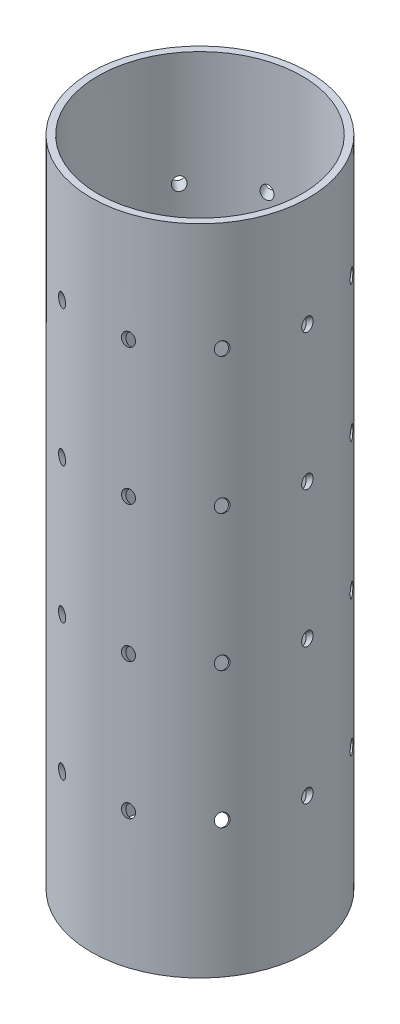
from build123d import *

# Parameters (mm, degrees)
SKETCH1_R                  = 50.8
SKETCH1_R_2                = 47.625
BOSS_EXTRUDE1_DEPTH        = 304.8
CUT_EXTRUDE1_REACH         = 290.782
SKETCH4_R                  = 2.6162
CIRPATTERN1_COUNT          = 10
LPATTERN2_COPY_1_REACH     = 290.782
LPATTERN2_COPY_1_SKETCH_R  = 2.6162
LPATTERN2_COPY_2_REACH     = 290.782
LPATTERN2_COPY_2_SKETCH_R  = 2.6162
LPATTERN2_COPY_3_REACH     = 290.782
LPATTERN2_COPY_3_SKETCH_R  = 2.6162
LPATTERN2_COPY_4_REACH     = 290.782
LPATTERN2_COPY_4_SKETCH_R  = 2.6162
LPATTERN2_COPY_5_REACH     = 290.782
LPATTERN2_COPY_5_SKETCH_R  = 2.6162
LPATTERN2_COPY_6_REACH     = 290.782
LPATTERN2_COPY_6_SKETCH_R  = 2.6162
LPATTERN2_COPY_7_REACH     = 290.782
LPATTERN2_COPY_7_SKETCH_R  = 2.6162
LPATTERN2_COPY_8_REACH     = 290.782
LPATTERN2_COPY_8_SKETCH_R  = 2.6162
LPATTERN2_COPY_9_REACH     = 290.782
LPATTERN2_COPY_9_SKETCH_R  = 2.6162
LPATTERN2_COPY_10_REACH    = 290.782
LPATTERN2_COPY_10_SKETCH_R = 2.6162
LPATTERN2_COPY_11_REACH    = 290.782
LPATTERN2_COPY_11_SKETCH_R = 2.6162
LPATTERN2_COPY_12_REACH    = 290.782
LPATTERN2_COPY_12_SKETCH_R = 2.6162
LPATTERN2_COPY_13_REACH    = 290.782
LPATTERN2_COPY_13_SKETCH_R = 2.6162
LPATTERN2_COPY_14_REACH    = 290.782
LPATTERN2_COPY_14_SKETCH_R = 2.6162
LPATTERN2_COPY_15_REACH    = 290.782
LPATTERN2_COPY_15_SKETCH_R = 2.6162
LPATTERN2_COPY_16_REACH    = 290.782
LPATTERN2_COPY_16_SKETCH_R = 2.6162
LPATTERN2_COPY_17_REACH    = 290.782
LPATTERN2_COPY_17_SKETCH_R = 2.6162
LPATTERN2_COPY_18_REACH    = 290.782
LPATTERN2_COPY_18_SKETCH_R = 2.6162
LPATTERN2_COPY_19_REACH    = 290.782
LPATTERN2_COPY_19_SKETCH_R = 2.6162
LPATTERN2_COPY_20_REACH    = 290.782
LPATTERN2_COPY_20_SKETCH_R = 2.6162
LPATTERN2_COPY_21_REACH    = 290.782
LPATTERN2_COPY_21_SKETCH_R = 2.6162
LPATTERN2_COPY_22_REACH    = 290.782
LPATTERN2_COPY_22_SKETCH_R = 2.6162
LPATTERN2_COPY_23_REACH    = 290.782
LPATTERN2_COPY_23_SKETCH_R = 2.6162
LPATTERN2_COPY_24_REACH    = 290.782
LPATTERN2_COPY_24_SKETCH_R = 2.6162
LPATTERN2_COPY_25_REACH    = 290.782
LPATTERN2_COPY_25_SKETCH_R = 2.6162
LPATTERN2_COPY_26_REACH    = 290.782
LPATTERN2_COPY_26_SKETCH_R = 2.6162
LPATTERN2_COPY_27_REACH    = 290.782
LPATTERN2_COPY_27_SKETCH_R = 2.6162
LPATTERN2_COPY_28_REACH    = 290.782
LPATTERN2_COPY_28_SKETCH_R = 2.6162
LPATTERN2_COPY_29_REACH    = 290.782
LPATTERN2_COPY_29_SKETCH_R = 2.6162
LPATTERN2_COPY_30_REACH    = 290.782
LPATTERN2_COPY_30_SKETCH_R = 2.6162


with BuildPart() as part:
    # Sketch1 → Boss-Extrude1 (new body)
    with BuildSketch(Plane(origin=(0, 0, 0), x_dir=(1, 0, 0), z_dir=(0, 1, 0))):
        Circle(SKETCH1_R)
        Circle(SKETCH1_R_2, mode=Mode.SUBTRACT)
    extrude(amount=BOSS_EXTRUDE1_DEPTH)

    # Sketch4 → Cut-Extrude1 (cut, up to next)
    with BuildSketch(Plane(origin=(61.203230962, 261.284420742, 0), x_dir=(0, 0, -1), z_dir=(0.8191520442889912, 0.5735764363510469, 0)), mode=Mode.PRIVATE) as cut_extrude1_sk1:
        with Locations((-0.614368328, 0)):
            Circle(SKETCH4_R)
    cut_extrude1_tool1 = extrude(cut_extrude1_sk1.sketch, amount=-CUT_EXTRUDE1_REACH, mode=Mode.PRIVATE) & part.part
    cut_extrude1 = cut_extrude1_tool1.solids().sort_by_distance((61.203231, 261.284421, 0.614368))[0]
    add(cut_extrude1, mode=Mode.SUBTRACT)

    # CirPattern1: Cut-Extrude1 ×10 about axis
    cirpattern1_axis = Axis((0, 304.8, 0), (0, 1, 0))
    for i in range(1, CIRPATTERN1_COUNT):
        add(cut_extrude1.rotate(cirpattern1_axis, i * 360 / CIRPATTERN1_COUNT), mode=Mode.SUBTRACT)

    # LPattern2 copy 1 sketch → LPattern2 copy 1 (cut, up to next)
    with BuildSketch(Plane(origin=(49.514453959, 197.784420742, -35.974356552), x_dir=(-0.5877852522924731, 0, -0.8090169943749475), z_dir=(0.6627079248067735, 0.5735764363510469, -0.48148549101829985)), mode=Mode.PRIVATE) as lpattern2_copy_1_sk1:
        with Locations((-0.614368328, 0)):
            Circle(LPATTERN2_COPY_1_SKETCH_R)
    lpattern2_copy_1_tool1 = extrude(lpattern2_copy_1_sk1.sketch, amount=-LPATTERN2_COPY_1_REACH, mode=Mode.PRIVATE) & part.part
    add(lpattern2_copy_1_tool1.solids().sort_by_distance((49.87557044, 197.784421, -35.477322422))[0], mode=Mode.SUBTRACT)

    # LPattern2 copy 2 sketch → LPattern2 copy 2 (cut, up to next)
    with BuildSketch(Plane(origin=(49.514453959, 134.284420742, -35.974356552), x_dir=(-0.5877852522924731, 0, -0.8090169943749475), z_dir=(0.6627079248067735, 0.5735764363510469, -0.48148549101829985)), mode=Mode.PRIVATE) as lpattern2_copy_2_sk1:
        with Locations((-0.614368328, 0)):
            Circle(LPATTERN2_COPY_2_SKETCH_R)
    lpattern2_copy_2_tool1 = extrude(lpattern2_copy_2_sk1.sketch, amount=-LPATTERN2_COPY_2_REACH, mode=Mode.PRIVATE) & part.part
    add(lpattern2_copy_2_tool1.solids().sort_by_distance((49.87557044, 134.284421, -35.477322422))[0], mode=Mode.SUBTRACT)

    # LPattern2 copy 3 sketch → LPattern2 copy 3 (cut, up to next)
    with BuildSketch(Plane(origin=(49.514453959, 70.784420742, -35.974356552), x_dir=(-0.5877852522924731, 0, -0.8090169943749475), z_dir=(0.6627079248067735, 0.5735764363510469, -0.48148549101829985)), mode=Mode.PRIVATE) as lpattern2_copy_3_sk1:
        with Locations((-0.614368328, 0)):
            Circle(LPATTERN2_COPY_3_SKETCH_R)
    lpattern2_copy_3_tool1 = extrude(lpattern2_copy_3_sk1.sketch, amount=-LPATTERN2_COPY_3_REACH, mode=Mode.PRIVATE) & part.part
    add(lpattern2_copy_3_tool1.solids().sort_by_distance((49.87557044, 70.784421, -35.477322422))[0], mode=Mode.SUBTRACT)

    # LPattern2 copy 4 sketch → LPattern2 copy 4 (cut, up to next)
    with BuildSketch(Plane(origin=(18.912838478, 197.784420742, -58.207731625), x_dir=(-0.9510565162951535, 0, -0.30901699437494745), z_dir=(0.2531319026622779, 0.5735764363510469, -0.7790598895575414)), mode=Mode.PRIVATE) as lpattern2_copy_4_sk1:
        with Locations((-0.614368328, 0)):
            Circle(LPATTERN2_COPY_4_SKETCH_R)
    lpattern2_copy_4_tool1 = extrude(lpattern2_copy_4_sk1.sketch, amount=-LPATTERN2_COPY_4_REACH, mode=Mode.PRIVATE) & part.part
    add(lpattern2_copy_4_tool1.solids().sort_by_distance((19.497137179, 197.784421, -58.017881508))[0], mode=Mode.SUBTRACT)

    # LPattern2 copy 5 sketch → LPattern2 copy 5 (cut, up to next)
    with BuildSketch(Plane(origin=(18.912838478, 134.284420742, -58.207731625), x_dir=(-0.9510565162951535, 0, -0.30901699437494745), z_dir=(0.2531319026622779, 0.5735764363510469, -0.7790598895575414)), mode=Mode.PRIVATE) as lpattern2_copy_5_sk1:
        with Locations((-0.614368328, 0)):
            Circle(LPATTERN2_COPY_5_SKETCH_R)
    lpattern2_copy_5_tool1 = extrude(lpattern2_copy_5_sk1.sketch, amount=-LPATTERN2_COPY_5_REACH, mode=Mode.PRIVATE) & part.part
    add(lpattern2_copy_5_tool1.solids().sort_by_distance((19.497137179, 134.284421, -58.017881508))[0], mode=Mode.SUBTRACT)

    # LPattern2 copy 6 sketch → LPattern2 copy 6 (cut, up to next)
    with BuildSketch(Plane(origin=(18.912838478, 70.784420742, -58.207731625), x_dir=(-0.9510565162951535, 0, -0.30901699437494745), z_dir=(0.2531319026622779, 0.5735764363510469, -0.7790598895575414)), mode=Mode.PRIVATE) as lpattern2_copy_6_sk1:
        with Locations((-0.614368328, 0)):
            Circle(LPATTERN2_COPY_6_SKETCH_R)
    lpattern2_copy_6_tool1 = extrude(lpattern2_copy_6_sk1.sketch, amount=-LPATTERN2_COPY_6_REACH, mode=Mode.PRIVATE) & part.part
    add(lpattern2_copy_6_tool1.solids().sort_by_distance((19.497137179, 70.784421, -58.017881508))[0], mode=Mode.SUBTRACT)

    # LPattern2 copy 7 sketch → LPattern2 copy 7 (cut, up to next)
    with BuildSketch(Plane(origin=(-18.912838478, 197.784420742, -58.207731625), x_dir=(-0.9510565162951536, 0, 0.30901699437494734), z_dir=(-0.2531319026622778, 0.5735764363510469, -0.7790598895575415)), mode=Mode.PRIVATE) as lpattern2_copy_7_sk1:
        with Locations((-0.614368328, 0)):
            Circle(LPATTERN2_COPY_7_SKETCH_R)
    lpattern2_copy_7_tool1 = extrude(lpattern2_copy_7_sk1.sketch, amount=-LPATTERN2_COPY_7_REACH, mode=Mode.PRIVATE) & part.part
    add(lpattern2_copy_7_tool1.solids().sort_by_distance((-18.3285398, 197.784421, -58.397581814))[0], mode=Mode.SUBTRACT)

    # LPattern2 copy 8 sketch → LPattern2 copy 8 (cut, up to next)
    with BuildSketch(Plane(origin=(-18.912838478, 134.284420742, -58.207731625), x_dir=(-0.9510565162951536, 0, 0.30901699437494734), z_dir=(-0.2531319026622778, 0.5735764363510469, -0.7790598895575415)), mode=Mode.PRIVATE) as lpattern2_copy_8_sk1:
        with Locations((-0.614368328, 0)):
            Circle(LPATTERN2_COPY_8_SKETCH_R)
    lpattern2_copy_8_tool1 = extrude(lpattern2_copy_8_sk1.sketch, amount=-LPATTERN2_COPY_8_REACH, mode=Mode.PRIVATE) & part.part
    add(lpattern2_copy_8_tool1.solids().sort_by_distance((-18.3285398, 134.284421, -58.397581814))[0], mode=Mode.SUBTRACT)

    # LPattern2 copy 9 sketch → LPattern2 copy 9 (cut, up to next)
    with BuildSketch(Plane(origin=(-18.912838478, 70.784420742, -58.207731625), x_dir=(-0.9510565162951536, 0, 0.30901699437494734), z_dir=(-0.2531319026622778, 0.5735764363510469, -0.7790598895575415)), mode=Mode.PRIVATE) as lpattern2_copy_9_sk1:
        with Locations((-0.614368328, 0)):
            Circle(LPATTERN2_COPY_9_SKETCH_R)
    lpattern2_copy_9_tool1 = extrude(lpattern2_copy_9_sk1.sketch, amount=-LPATTERN2_COPY_9_REACH, mode=Mode.PRIVATE) & part.part
    add(lpattern2_copy_9_tool1.solids().sort_by_distance((-18.3285398, 70.784421, -58.397581814))[0], mode=Mode.SUBTRACT)

    # LPattern2 copy 10 sketch → LPattern2 copy 10 (cut, up to next)
    with BuildSketch(Plane(origin=(-49.514453959, 197.784420742, -35.974356552), x_dir=(-0.5877852522924732, 0, 0.8090169943749473), z_dir=(-0.6627079248067734, 0.5735764363510469, -0.48148549101829996)), mode=Mode.PRIVATE) as lpattern2_copy_10_sk1:
        with Locations((-0.614368328, 0)):
            Circle(LPATTERN2_COPY_10_SKETCH_R)
    lpattern2_copy_10_tool1 = extrude(lpattern2_copy_10_sk1.sketch, amount=-LPATTERN2_COPY_10_REACH, mode=Mode.PRIVATE) & part.part
    add(lpattern2_copy_10_tool1.solids().sort_by_distance((-49.15333754, 197.784421, -36.471390727))[0], mode=Mode.SUBTRACT)

    # LPattern2 copy 11 sketch → LPattern2 copy 11 (cut, up to next)
    with BuildSketch(Plane(origin=(-49.514453959, 134.284420742, -35.974356552), x_dir=(-0.5877852522924732, 0, 0.8090169943749473), z_dir=(-0.6627079248067734, 0.5735764363510469, -0.48148549101829996)), mode=Mode.PRIVATE) as lpattern2_copy_11_sk1:
        with Locations((-0.614368328, 0)):
            Circle(LPATTERN2_COPY_11_SKETCH_R)
    lpattern2_copy_11_tool1 = extrude(lpattern2_copy_11_sk1.sketch, amount=-LPATTERN2_COPY_11_REACH, mode=Mode.PRIVATE) & part.part
    add(lpattern2_copy_11_tool1.solids().sort_by_distance((-49.15333754, 134.284421, -36.471390727))[0], mode=Mode.SUBTRACT)

    # LPattern2 copy 12 sketch → LPattern2 copy 12 (cut, up to next)
    with BuildSketch(Plane(origin=(-49.514453959, 70.784420742, -35.974356552), x_dir=(-0.5877852522924732, 0, 0.8090169943749473), z_dir=(-0.6627079248067734, 0.5735764363510469, -0.48148549101829996)), mode=Mode.PRIVATE) as lpattern2_copy_12_sk1:
        with Locations((-0.614368328, 0)):
            Circle(LPATTERN2_COPY_12_SKETCH_R)
    lpattern2_copy_12_tool1 = extrude(lpattern2_copy_12_sk1.sketch, amount=-LPATTERN2_COPY_12_REACH, mode=Mode.PRIVATE) & part.part
    add(lpattern2_copy_12_tool1.solids().sort_by_distance((-49.15333754, 70.784421, -36.471390727))[0], mode=Mode.SUBTRACT)

    # LPattern2 copy 13 sketch → LPattern2 copy 13 (cut, up to next)
    with BuildSketch(Plane(origin=(-61.203230962, 197.784420742, 0), x_dir=(0, 0, 1), z_dir=(-0.8191520442889912, 0.5735764363510469, 0)), mode=Mode.PRIVATE) as lpattern2_copy_13_sk1:
        with Locations((-0.614368328, 0)):
            Circle(LPATTERN2_COPY_13_SKETCH_R)
    lpattern2_copy_13_tool1 = extrude(lpattern2_copy_13_sk1.sketch, amount=-LPATTERN2_COPY_13_REACH, mode=Mode.PRIVATE) & part.part
    add(lpattern2_copy_13_tool1.solids().sort_by_distance((-61.203231, 197.784421, -0.614368))[0], mode=Mode.SUBTRACT)

    # LPattern2 copy 14 sketch → LPattern2 copy 14 (cut, up to next)
    with BuildSketch(Plane(origin=(-61.203230962, 134.284420742, 0), x_dir=(0, 0, 1), z_dir=(-0.8191520442889912, 0.5735764363510469, 0)), mode=Mode.PRIVATE) as lpattern2_copy_14_sk1:
        with Locations((-0.614368328, 0)):
            Circle(LPATTERN2_COPY_14_SKETCH_R)
    lpattern2_copy_14_tool1 = extrude(lpattern2_copy_14_sk1.sketch, amount=-LPATTERN2_COPY_14_REACH, mode=Mode.PRIVATE) & part.part
    add(lpattern2_copy_14_tool1.solids().sort_by_distance((-61.203231, 134.284421, -0.614368))[0], mode=Mode.SUBTRACT)

    # LPattern2 copy 15 sketch → LPattern2 copy 15 (cut, up to next)
    with BuildSketch(Plane(origin=(-61.203230962, 70.784420742, 0), x_dir=(0, 0, 1), z_dir=(-0.8191520442889912, 0.5735764363510469, 0)), mode=Mode.PRIVATE) as lpattern2_copy_15_sk1:
        with Locations((-0.614368328, 0)):
            Circle(LPATTERN2_COPY_15_SKETCH_R)
    lpattern2_copy_15_tool1 = extrude(lpattern2_copy_15_sk1.sketch, amount=-LPATTERN2_COPY_15_REACH, mode=Mode.PRIVATE) & part.part
    add(lpattern2_copy_15_tool1.solids().sort_by_distance((-61.203231, 70.784421, -0.614368))[0], mode=Mode.SUBTRACT)

    # LPattern2 copy 16 sketch → LPattern2 copy 16 (cut, up to next)
    with BuildSketch(Plane(origin=(-49.514453959, 197.784420742, 35.974356552), x_dir=(0.587785252292473, 0, 0.8090169943749476), z_dir=(-0.6627079248067737, 0.5735764363510468, 0.48148549101829974)), mode=Mode.PRIVATE) as lpattern2_copy_16_sk1:
        with Locations((-0.614368328, 0)):
            Circle(LPATTERN2_COPY_16_SKETCH_R)
    lpattern2_copy_16_tool1 = extrude(lpattern2_copy_16_sk1.sketch, amount=-LPATTERN2_COPY_16_REACH, mode=Mode.PRIVATE) & part.part
    add(lpattern2_copy_16_tool1.solids().sort_by_distance((-49.87557044, 197.784421, 35.477322422))[0], mode=Mode.SUBTRACT)

    # LPattern2 copy 17 sketch → LPattern2 copy 17 (cut, up to next)
    with BuildSketch(Plane(origin=(-49.514453959, 134.284420742, 35.974356552), x_dir=(0.587785252292473, 0, 0.8090169943749476), z_dir=(-0.6627079248067737, 0.5735764363510468, 0.48148549101829974)), mode=Mode.PRIVATE) as lpattern2_copy_17_sk1:
        with Locations((-0.614368328, 0)):
            Circle(LPATTERN2_COPY_17_SKETCH_R)
    lpattern2_copy_17_tool1 = extrude(lpattern2_copy_17_sk1.sketch, amount=-LPATTERN2_COPY_17_REACH, mode=Mode.PRIVATE) & part.part
    add(lpattern2_copy_17_tool1.solids().sort_by_distance((-49.87557044, 134.284421, 35.477322422))[0], mode=Mode.SUBTRACT)

    # LPattern2 copy 18 sketch → LPattern2 copy 18 (cut, up to next)
    with BuildSketch(Plane(origin=(-49.514453959, 70.784420742, 35.974356552), x_dir=(0.587785252292473, 0, 0.8090169943749476), z_dir=(-0.6627079248067737, 0.5735764363510468, 0.48148549101829974)), mode=Mode.PRIVATE) as lpattern2_copy_18_sk1:
        with Locations((-0.614368328, 0)):
            Circle(LPATTERN2_COPY_18_SKETCH_R)
    lpattern2_copy_18_tool1 = extrude(lpattern2_copy_18_sk1.sketch, amount=-LPATTERN2_COPY_18_REACH, mode=Mode.PRIVATE) & part.part
    add(lpattern2_copy_18_tool1.solids().sort_by_distance((-49.87557044, 70.784421, 35.477322422))[0], mode=Mode.SUBTRACT)

    # LPattern2 copy 19 sketch → LPattern2 copy 19 (cut, up to next)
    with BuildSketch(Plane(origin=(-18.912838478, 197.784420742, 58.207731625), x_dir=(0.9510565162951535, 0, 0.30901699437494756), z_dir=(-0.25313190266227803, 0.5735764363510468, 0.7790598895575414)), mode=Mode.PRIVATE) as lpattern2_copy_19_sk1:
        with Locations((-0.614368328, 0)):
            Circle(LPATTERN2_COPY_19_SKETCH_R)
    lpattern2_copy_19_tool1 = extrude(lpattern2_copy_19_sk1.sketch, amount=-LPATTERN2_COPY_19_REACH, mode=Mode.PRIVATE) & part.part
    add(lpattern2_copy_19_tool1.solids().sort_by_distance((-19.497137179, 197.784421, 58.017881508))[0], mode=Mode.SUBTRACT)

    # LPattern2 copy 20 sketch → LPattern2 copy 20 (cut, up to next)
    with BuildSketch(Plane(origin=(-18.912838478, 134.284420742, 58.207731625), x_dir=(0.9510565162951535, 0, 0.30901699437494756), z_dir=(-0.25313190266227803, 0.5735764363510468, 0.7790598895575414)), mode=Mode.PRIVATE) as lpattern2_copy_20_sk1:
        with Locations((-0.614368328, 0)):
            Circle(LPATTERN2_COPY_20_SKETCH_R)
    lpattern2_copy_20_tool1 = extrude(lpattern2_copy_20_sk1.sketch, amount=-LPATTERN2_COPY_20_REACH, mode=Mode.PRIVATE) & part.part
    add(lpattern2_copy_20_tool1.solids().sort_by_distance((-19.497137179, 134.284421, 58.017881508))[0], mode=Mode.SUBTRACT)

    # LPattern2 copy 21 sketch → LPattern2 copy 21 (cut, up to next)
    with BuildSketch(Plane(origin=(-18.912838478, 70.784420742, 58.207731625), x_dir=(0.9510565162951535, 0, 0.30901699437494756), z_dir=(-0.25313190266227803, 0.5735764363510468, 0.7790598895575414)), mode=Mode.PRIVATE) as lpattern2_copy_21_sk1:
        with Locations((-0.614368328, 0)):
            Circle(LPATTERN2_COPY_21_SKETCH_R)
    lpattern2_copy_21_tool1 = extrude(lpattern2_copy_21_sk1.sketch, amount=-LPATTERN2_COPY_21_REACH, mode=Mode.PRIVATE) & part.part
    add(lpattern2_copy_21_tool1.solids().sort_by_distance((-19.497137179, 70.784421, 58.017881508))[0], mode=Mode.SUBTRACT)

    # LPattern2 copy 22 sketch → LPattern2 copy 22 (cut, up to next)
    with BuildSketch(Plane(origin=(18.912838478, 197.784420742, 58.207731625), x_dir=(0.9510565162951536, 0, -0.30901699437494723), z_dir=(0.25313190266227775, 0.5735764363510469, 0.7790598895575415)), mode=Mode.PRIVATE) as lpattern2_copy_22_sk1:
        with Locations((-0.614368328, 0)):
            Circle(LPATTERN2_COPY_22_SKETCH_R)
    lpattern2_copy_22_tool1 = extrude(lpattern2_copy_22_sk1.sketch, amount=-LPATTERN2_COPY_22_REACH, mode=Mode.PRIVATE) & part.part
    add(lpattern2_copy_22_tool1.solids().sort_by_distance((18.3285398, 197.784421, 58.397581814))[0], mode=Mode.SUBTRACT)

    # LPattern2 copy 23 sketch → LPattern2 copy 23 (cut, up to next)
    with BuildSketch(Plane(origin=(18.912838478, 134.284420742, 58.207731625), x_dir=(0.9510565162951536, 0, -0.30901699437494723), z_dir=(0.25313190266227775, 0.5735764363510469, 0.7790598895575415)), mode=Mode.PRIVATE) as lpattern2_copy_23_sk1:
        with Locations((-0.614368328, 0)):
            Circle(LPATTERN2_COPY_23_SKETCH_R)
    lpattern2_copy_23_tool1 = extrude(lpattern2_copy_23_sk1.sketch, amount=-LPATTERN2_COPY_23_REACH, mode=Mode.PRIVATE) & part.part
    add(lpattern2_copy_23_tool1.solids().sort_by_distance((18.3285398, 134.284421, 58.397581814))[0], mode=Mode.SUBTRACT)

    # LPattern2 copy 24 sketch → LPattern2 copy 24 (cut, up to next)
    with BuildSketch(Plane(origin=(18.912838478, 70.784420742, 58.207731625), x_dir=(0.9510565162951536, 0, -0.30901699437494723), z_dir=(0.25313190266227775, 0.5735764363510469, 0.7790598895575415)), mode=Mode.PRIVATE) as lpattern2_copy_24_sk1:
        with Locations((-0.614368328, 0)):
            Circle(LPATTERN2_COPY_24_SKETCH_R)
    lpattern2_copy_24_tool1 = extrude(lpattern2_copy_24_sk1.sketch, amount=-LPATTERN2_COPY_24_REACH, mode=Mode.PRIVATE) & part.part
    add(lpattern2_copy_24_tool1.solids().sort_by_distance((18.3285398, 70.784421, 58.397581814))[0], mode=Mode.SUBTRACT)

    # LPattern2 copy 25 sketch → LPattern2 copy 25 (cut, up to next)
    with BuildSketch(Plane(origin=(49.514453959, 197.784420742, 35.974356552), x_dir=(0.5877852522924734, 0, -0.8090169943749473), z_dir=(0.6627079248067734, 0.5735764363510469, 0.4814854910183)), mode=Mode.PRIVATE) as lpattern2_copy_25_sk1:
        with Locations((-0.614368328, 0)):
            Circle(LPATTERN2_COPY_25_SKETCH_R)
    lpattern2_copy_25_tool1 = extrude(lpattern2_copy_25_sk1.sketch, amount=-LPATTERN2_COPY_25_REACH, mode=Mode.PRIVATE) & part.part
    add(lpattern2_copy_25_tool1.solids().sort_by_distance((49.15333754, 197.784421, 36.471390727))[0], mode=Mode.SUBTRACT)

    # LPattern2 copy 26 sketch → LPattern2 copy 26 (cut, up to next)
    with BuildSketch(Plane(origin=(49.514453959, 134.284420742, 35.974356552), x_dir=(0.5877852522924734, 0, -0.8090169943749473), z_dir=(0.6627079248067734, 0.5735764363510469, 0.4814854910183)), mode=Mode.PRIVATE) as lpattern2_copy_26_sk1:
        with Locations((-0.614368328, 0)):
            Circle(LPATTERN2_COPY_26_SKETCH_R)
    lpattern2_copy_26_tool1 = extrude(lpattern2_copy_26_sk1.sketch, amount=-LPATTERN2_COPY_26_REACH, mode=Mode.PRIVATE) & part.part
    add(lpattern2_copy_26_tool1.solids().sort_by_distance((49.15333754, 134.284421, 36.471390727))[0], mode=Mode.SUBTRACT)

    # LPattern2 copy 27 sketch → LPattern2 copy 27 (cut, up to next)
    with BuildSketch(Plane(origin=(49.514453959, 70.784420742, 35.974356552), x_dir=(0.5877852522924734, 0, -0.8090169943749473), z_dir=(0.6627079248067734, 0.5735764363510469, 0.4814854910183)), mode=Mode.PRIVATE) as lpattern2_copy_27_sk1:
        with Locations((-0.614368328, 0)):
            Circle(LPATTERN2_COPY_27_SKETCH_R)
    lpattern2_copy_27_tool1 = extrude(lpattern2_copy_27_sk1.sketch, amount=-LPATTERN2_COPY_27_REACH, mode=Mode.PRIVATE) & part.part
    add(lpattern2_copy_27_tool1.solids().sort_by_distance((49.15333754, 70.784421, 36.471390727))[0], mode=Mode.SUBTRACT)

    # LPattern2 copy 28 sketch → LPattern2 copy 28 (cut, up to next)
    with BuildSketch(Plane(origin=(61.203230962, 197.784420742, 0), x_dir=(0, 0, -1), z_dir=(0.8191520442889912, 0.5735764363510469, 0)), mode=Mode.PRIVATE) as lpattern2_copy_28_sk1:
        with Locations((-0.614368328, 0)):
            Circle(LPATTERN2_COPY_28_SKETCH_R)
    lpattern2_copy_28_tool1 = extrude(lpattern2_copy_28_sk1.sketch, amount=-LPATTERN2_COPY_28_REACH, mode=Mode.PRIVATE) & part.part
    add(lpattern2_copy_28_tool1.solids().sort_by_distance((61.203231, 197.784421, 0.614368))[0], mode=Mode.SUBTRACT)

    # LPattern2 copy 29 sketch → LPattern2 copy 29 (cut, up to next)
    with BuildSketch(Plane(origin=(61.203230962, 134.284420742, 0), x_dir=(0, 0, -1), z_dir=(0.8191520442889912, 0.5735764363510469, 0)), mode=Mode.PRIVATE) as lpattern2_copy_29_sk1:
        with Locations((-0.614368328, 0)):
            Circle(LPATTERN2_COPY_29_SKETCH_R)
    lpattern2_copy_29_tool1 = extrude(lpattern2_copy_29_sk1.sketch, amount=-LPATTERN2_COPY_29_REACH, mode=Mode.PRIVATE) & part.part
    add(lpattern2_copy_29_tool1.solids().sort_by_distance((61.203231, 134.284421, 0.614368))[0], mode=Mode.SUBTRACT)

    # LPattern2 copy 30 sketch → LPattern2 copy 30 (cut, up to next)
    with BuildSketch(Plane(origin=(61.203230962, 70.784420742, 0), x_dir=(0, 0, -1), z_dir=(0.8191520442889912, 0.5735764363510469, 0)), mode=Mode.PRIVATE) as lpattern2_copy_30_sk1:
        with Locations((-0.614368328, 0)):
            Circle(LPATTERN2_COPY_30_SKETCH_R)
    lpattern2_copy_30_tool1 = extrude(lpattern2_copy_30_sk1.sketch, amount=-LPATTERN2_COPY_30_REACH, mode=Mode.PRIVATE) & part.part
    add(lpattern2_copy_30_tool1.solids().sort_by_distance((61.203231, 70.784421, 0.614368))[0], mode=Mode.SUBTRACT)


solid = part.part
